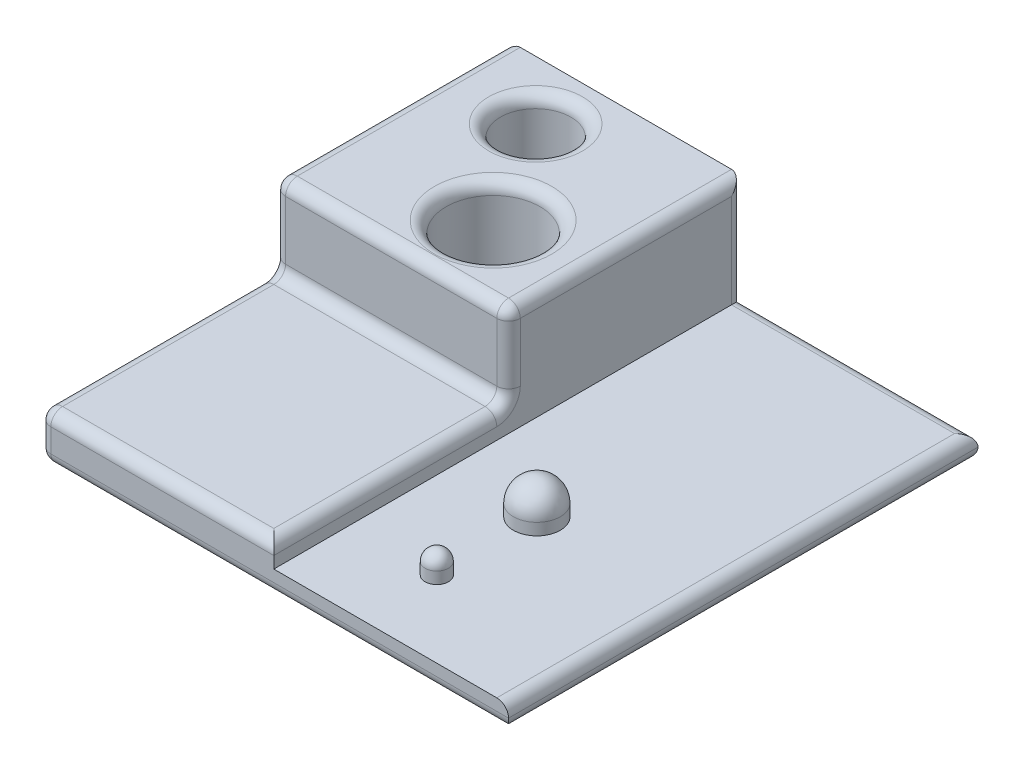
from build123d import *

# Parameters (mm, degrees)
SKETCH1_W           = 10
SKETCH1_H           = 20
BOSS_EXTRUDE1_DEPTH = 2
SKETCH2_W           = 10
SKETCH2_H           = 20
BOSS_EXTRUDE2_DEPTH = 1
SKETCH3_R           = 0.5
BOSS_EXTRUDE3_DEPTH = 1
FILLET1_R           = 0.5
SKETCH4_R           = 1
BOSS_EXTRUDE4_DEPTH = 1.5
FILLET2_R           = 1
SKETCH5_W           = 10
SKETCH5_H           = 10
BOSS_EXTRUDE5_DEPTH = 3.5
SKETCH7_R           = 1.5
CUT_EXTRUDE1_DEPTH  = 4
SKETCH8_R           = 2
CUT_EXTRUDE2_DEPTH  = 5
FILLET3_R           = 0.5


with BuildPart() as part:
    # Sketch1 → Boss-Extrude1 (new body)
    with BuildSketch(Plane(origin=(0, 0, 0), x_dir=(1, 0, 0), z_dir=(0, 1, 0))):
        with Locations((5, 10)):
            Rectangle(SKETCH1_W, SKETCH1_H)
    extrude(amount=BOSS_EXTRUDE1_DEPTH)

    # Sketch2 → Boss-Extrude2 (add)
    with BuildSketch(Plane(origin=(0, 0, 0), x_dir=(1, 0, 0), z_dir=(0, 1, 0))):
        with Locations((15, 10)):
            Rectangle(SKETCH2_W, SKETCH2_H)
    extrude(amount=BOSS_EXTRUDE2_DEPTH)

    # Sketch3 → Boss-Extrude3 (add)
    with BuildSketch(Plane(origin=(0, 1, 0), x_dir=(1, 0, 0), z_dir=(0, 1, 0))):
        with Locations(Location((13.691502903, 3.252748725, 0), (0, 0, 90))):
            Circle(SKETCH3_R)
    extrude(amount=BOSS_EXTRUDE3_DEPTH)

    # Fillet1
    fillet1_edges = [part.edges().sort_by_distance(p)[0] for p in [
        (13.691502903, 2, -2.752748725),
    ]]
    fillet(fillet1_edges, radius=FILLET1_R)

    # Sketch4 → Boss-Extrude4 (add)
    with BuildSketch(Plane(origin=(0, 1, 0), x_dir=(1, 0, 0), z_dir=(0, 1, 0))):
        with Locations(Location((13.672959069, 7.53387034, 0), (0, 0, 90))):
            Circle(SKETCH4_R)
    extrude(amount=BOSS_EXTRUDE4_DEPTH)

    # Fillet2
    fillet2_edges = [part.edges().sort_by_distance(p)[0] for p in [
        (13.672959069, 2.5, -6.53387034),
    ]]
    fillet(fillet2_edges, radius=FILLET2_R)

    # Sketch5 → Boss-Extrude5 (add)
    with BuildSketch(Plane(origin=(0, 2, 0), x_dir=(1, 0, 0), z_dir=(0, 1, 0))):
        with Locations((5, 15)):
            Rectangle(SKETCH5_W, SKETCH5_H)
    extrude(amount=BOSS_EXTRUDE5_DEPTH)

    # Sketch7 → Cut-Extrude1 (cut)
    with BuildSketch(Plane(origin=(0, 5.5, 0), x_dir=(1, 0, 0), z_dir=(0, 1, 0))):
        with Locations(Location((3.651027896, 17.503330669, 0), (0, 0, 270))):
            Circle(SKETCH7_R)
    extrude(amount=-CUT_EXTRUDE1_DEPTH, mode=Mode.SUBTRACT)

    # Sketch8 → Cut-Extrude2 (cut)
    with BuildSketch(Plane(origin=(0, 5.5, 0), x_dir=(1, 0, 0), z_dir=(0, 1, 0))):
        with Locations(Location((6.300805509, 13.043308943, 0), (0, 0, 270))):
            Circle(SKETCH8_R)
    extrude(amount=-CUT_EXTRUDE2_DEPTH, mode=Mode.SUBTRACT)

    # Fillet3
    fillet3_edges = [part.edges().sort_by_distance(p)[0] for p in [
        (0, 2, -5),
        (20, 0, -10),
        (20, 1, -10),
        (10, 0, -20),
        (0, 0, -10),
        (10, 0, 0),
        (0, 1, 0),
        (5, 2, 0),
        (5, 2, -10),
        (10, 2, -5),
        (15, 1, -20),
        (0, 2.75, -20),
        (10, 3.25, -20),
        (10, 5.5, -15),
        (10, 3.75, -10),
        (0, 3.75, -10),
        (0, 5.5, -15),
        (5, 5.5, -10),
        (6.300805509, 5.5, -15.043308943),
        (3.651027896, 5.5, -19.003330669),
    ]]
    fillet(fillet3_edges, radius=FILLET3_R - 0.0001)  # a hair under: the kernel refuses the full size


solid = part.part
